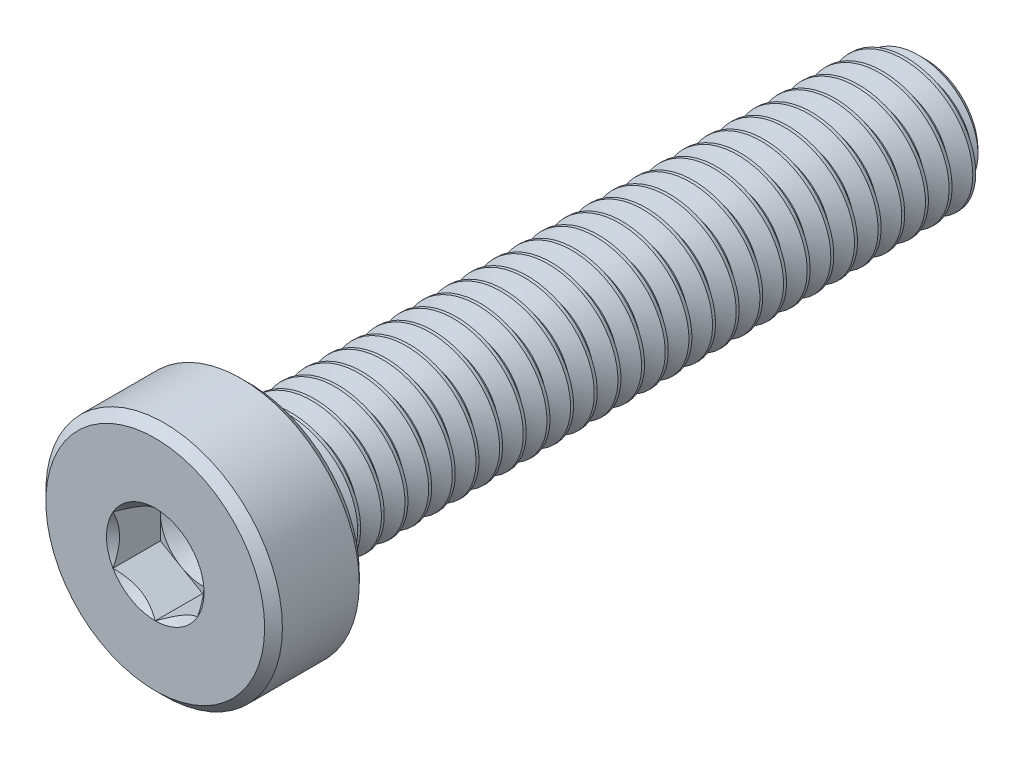
from build123d import *

# Parameters (mm, degrees)
CUT_EXTRUDE1_DEPTH = 1.4
CUT_SWEEP1_PITCH   = 0.7


with BuildPart() as part:
    # Sketch2 → Revolve1 (revolve)
    with BuildSketch(Plane(origin=(0, 0, 0), x_dir=(0, 0, -1), z_dir=(1, 0, 0)), mode=Mode.PRIVATE) as revolve1_sk:
        with BuildLine():
            Line((-8.8625, 3.5), (-8.6, 3.2375))
            Line((-8.6, 3.2375), (-8.6, 2.2))
            ThreePointArc((-8.6, 2.2), (-8.541421356, 2.058578644), (-8.4, 2))
            Line((-8.4, 2), (10.945336663, 2))
            Line((10.945336663, 2), (11.4, 1.545336663))
            Line((11.4, 1.545336663), (11.4, 0))
            Line((11.4, 0), (-10, 0))
            Line((-10, 0), (-10, 1.25))
            Line((-10, 1.25), (-11.4, 1.25))
            Line((-11.4, 1.25), (-11.4, 3.2375))
            Line((-11.4, 3.2375), (-11.1375, 3.5))
            Line((-11.1375, 3.5), (-8.8625, 3.5))
        make_face()
    revolve(revolve1_sk.sketch.rotate(Axis((0, 0, 10), (0, 0, -1)), 90), axis=Axis((0, 0, 10), (0, 0, -1)))

    # Sketch3 → Cut-Extrude1 (cut)
    with BuildSketch(Plane.XY.offset(11.4)):
        Polygon((0, 1.443375673), (-1.25, 0.721687836), (-1.25, -0.721687836), (0, -1.443375673), (1.25, -0.721687836), (1.25, 0.721687836), align=None)
    extrude(amount=-CUT_EXTRUDE1_DEPTH, mode=Mode.SUBTRACT)

    # Cut-Extrude2 cone 1 section (through the dimple's axis) → Cut-Extrude2 (revolve, cut)
    with BuildSketch(Plane(origin=(0, 0, 11.4), x_dir=(0, -1, 0), z_dir=(1, 0, 0))):
        Polygon((0, 0), (1.443375673, 0), (0, 1.443375673), align=None)
    revolve(axis=Axis((0, 0, 11.4), (0, 0, -1)), mode=Mode.SUBTRACT)

    # Cut-Extrude5 cone 1 section (through the dimple's axis) → Cut-Extrude5 (revolve, cut)
    with BuildSketch(Plane(origin=(0, 0, 10), x_dir=(0, -1, 0), z_dir=(1, 0, 0))):
        Polygon((0, 0), (1.25, 0), (0, 0.721687836), align=None)
    revolve(axis=Axis((0, 0, 10), (0, 0, -1)), mode=Mode.SUBTRACT)

    # Cut-Sweep1: arcs per turn and ends read off the stored shape
    # Cut-Sweep1: the profile of Sketch8 screwed along a right-hand helix through 29.196429 turns, 6 arcs to a turn; built about Z, then put on its axis
    cut_sweep1_z = Axis((0, 0, 0), (0, 0, 1))
    cut_sweep1_corners = [(2.037888611, 0, 0.021875), (2.037888611, 0, -0.634375), (1.545336663, 0, -0.35), (1.545336663, 0, -0.2625)]
    with BuildLine(mode=Mode.PRIVATE) as cut_sweep1_profile:
        Line(cut_sweep1_corners[0], cut_sweep1_corners[1])
        Line(cut_sweep1_corners[1], cut_sweep1_corners[2])
        Line(cut_sweep1_corners[2], cut_sweep1_corners[3])
        Line(cut_sweep1_corners[3], cut_sweep1_corners[0])
    cut_sweep1_cap = Face(cut_sweep1_profile.wire())
    cut_sweep1_turn_angles = [0, 30, 60, 90, 120, 150, 180, 210, 240, 270, 300, 330, 360]
    cut_sweep1_turn_weights = [1, 0.8660254037844387, 1, 0.8660254037844387, 1, 0.8660254037844387, 1, 0.8660254037844387, 1, 0.8660254037844387, 1, 0.8660254037844387, 1]
    cut_sweep1_turn_rails = [Edge.make_bspline([Vector(p[0], p[1], 0).rotate(cut_sweep1_z, cut_sweep1_turn_angles[k]) / cut_sweep1_turn_weights[k] + Vector(0, 0, p[2] + CUT_SWEEP1_PITCH * cut_sweep1_turn_angles[k] / 360) for k in range(13)], [0, 0, 0, 1, 1, 2, 2, 3, 3, 4, 4, 5, 5, 6, 6, 6], 2, cut_sweep1_turn_weights) for p in cut_sweep1_corners]
    cut_sweep1_turn_sides = [Face.make_surface_from_curves(cut_sweep1_turn_rails[p[0]], cut_sweep1_turn_rails[p[1]]) for p in [(0, 1), (1, 2), (2, 3), (3, 0)]]
    cut_sweep1_last_angles = [10440, 10470, 10500, 10505.357142857, 10510.714285714]
    cut_sweep1_last_weights = [1, 0.8660254037844387, 1, 0.9956320789410119, 1]
    cut_sweep1_last_rails = [Edge.make_bspline([Vector(p[0], p[1], 0).rotate(cut_sweep1_z, cut_sweep1_last_angles[k]) / cut_sweep1_last_weights[k] + Vector(0, 0, p[2] + CUT_SWEEP1_PITCH * cut_sweep1_last_angles[k] / 360) for k in range(5)], [0, 0, 0, 1, 1, 2, 2, 2], 2, cut_sweep1_last_weights) for p in cut_sweep1_corners]
    cut_sweep1_last_sides = [Face.make_surface_from_curves(cut_sweep1_last_rails[p[0]], cut_sweep1_last_rails[p[1]]) for p in [(0, 1), (1, 2), (2, 3), (3, 0)]]
    cut_sweep1 = Plane(origin=(0, 0, -11.4), x_dir=(0, 1, 0), z_dir=(0, 0, 1)) * Solid(Shell([*[p.moved(Location((0, 0, CUT_SWEEP1_PITCH * i))) for i in range(29) for p in cut_sweep1_turn_sides], *cut_sweep1_last_sides, cut_sweep1_cap, cut_sweep1_cap.rotate(cut_sweep1_z, 10510.714285714).moved(Location((0, 0, CUT_SWEEP1_PITCH * 10510.714285714 / 360)))]))
    add(cut_sweep1, mode=Mode.SUBTRACT)

    # Sketch9 → Revolve2 (revolve)
    with BuildSketch(Plane(origin=(0, 0, 0), x_dir=(0, 0, -1), z_dir=(1, 0, 0)), mode=Mode.PRIVATE) as revolve2_sk:
        with BuildLine():
            Line((-9.08125, 0), (-9.08125, 2.2))
            Line((-9.08125, 2.2), (-8.6, 2.2))
            ThreePointArc((-8.6, 2.2), (-8.541421356, 2.058578644), (-8.4, 2))
            Line((-8.4, 2), (-7.9, 2))
            Line((-7.9, 2), (-6.745299462, 0))
            Line((-6.745299462, 0), (-9.08125, 0))
        make_face()
    revolve(revolve2_sk.sketch.rotate(Axis((0, 0, 6.745299462), (0, 0, 1)), 270), axis=Axis((0, 0, 6.745299462), (0, 0, 1)))


solid = part.part
